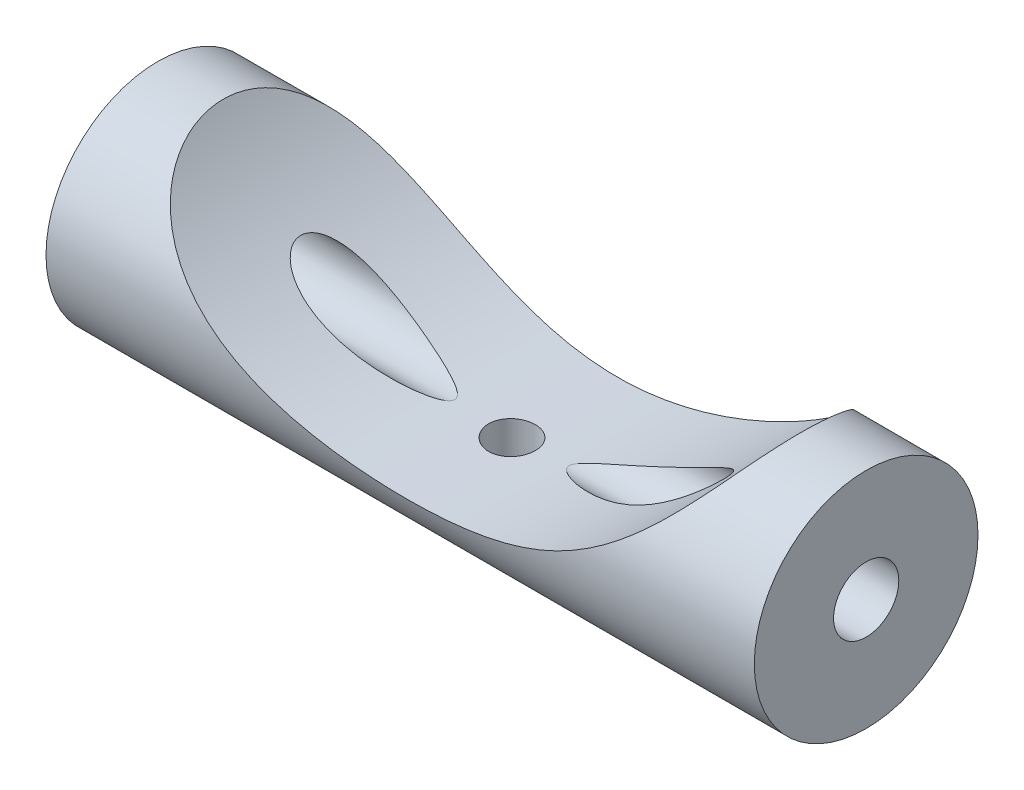
from build123d import *

# Parameters (mm, degrees)
SKETCH1_R               = 6
BOSS_EXTRUDE1_DEPTH     = 19
CUT_EXTRUDE1_DEPTH      = 21.808652047
CUT_EXTRUDE1_DEPTH_BACK = 21.808652047
SKETCH3_R               = 1.75
CUT_EXTRUDE2_DEPTH      = 20
SKETCH4_R               = 1.25
CUT_EXTRUDE3_DEPTH      = 21.808652197


with BuildPart() as part:
    # Sketch1 → Boss-Extrude1 (new, symmetric)
    with BuildSketch(Plane(origin=(0, 0, 0), x_dir=(0, 0, -1), z_dir=(1, 0, 0))):
        Circle(SKETCH1_R)
    extrude(amount=BOSS_EXTRUDE1_DEPTH, both=True)

    # Sketch2 → Cut-Extrude1 (cut, two sides: drawn at the far end of the back side and taken through both)
    with BuildSketch(Plane.XY.offset(-CUT_EXTRUDE1_DEPTH_BACK)):
        with BuildLine():
            Line((-63.567454446, 73.707524521), (-15.491933385, 6))
            ThreePointArc((-15.491933385, 6), (0, -2), (15.491933385, 6))
            Line((15.491933385, 6), (63.567454446, 73.707524521))
            Line((63.567454446, 73.707524521), (63.567454446, 239.786597279))
            Line((63.567454446, 239.786597279), (-63.567454446, 239.786597279))
            Line((-63.567454446, 239.786597279), (-63.567454446, 73.707524521))
        make_face()
    extrude(amount=CUT_EXTRUDE1_DEPTH + CUT_EXTRUDE1_DEPTH_BACK, mode=Mode.SUBTRACT)

    # Sketch3 → Cut-Extrude2 (cut, symmetric)
    with BuildSketch(Plane(origin=(0, 0, 0), x_dir=(0, 0, -1), z_dir=(1, 0, 0))):
        Circle(SKETCH3_R)
    extrude(amount=CUT_EXTRUDE2_DEPTH, both=True, mode=Mode.SUBTRACT)

    # Sketch4 → Cut-Extrude3 (cut, through all)
    with BuildSketch(Plane(origin=(0, 0, 0), x_dir=(1, 0, 0), z_dir=(0, 1, 0))):
        Circle(SKETCH4_R)
    extrude(amount=-CUT_EXTRUDE3_DEPTH, mode=Mode.SUBTRACT)


solid = part.part
